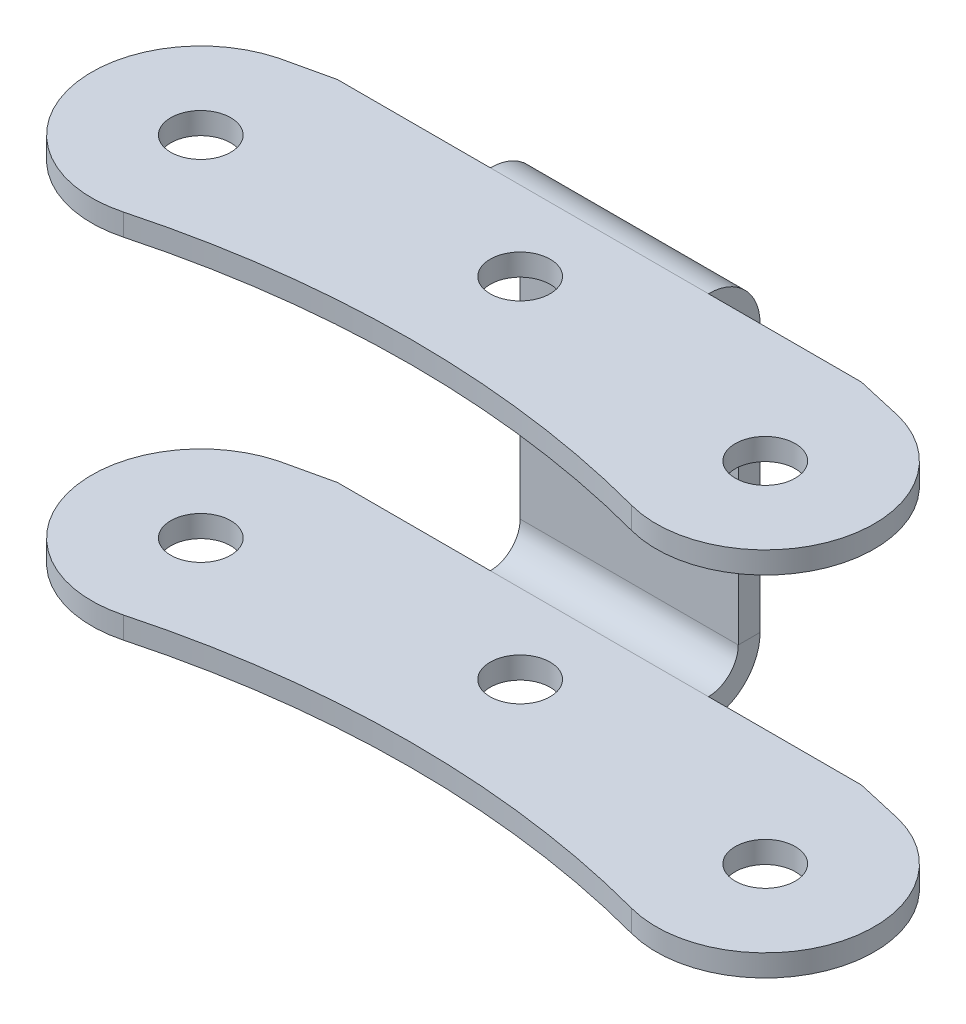
from build123d import *

# Parameters (mm, degrees)
SKETCH_1_W                       = 20
SKETCH_1_H                       = 34
SM_BASE_FLANGE_1_DEPTH           = 2
SM_EDGE_FLANGE_1_STRIP_W         = 13.4732
SM_EDGE_FLANGE_1_STRIP_H         = 2
SM_EDGE_FLANGE_1_STRIP_CUT_DEPTH = 20
SM_EDGE_FLANGE_1_DEPTH           = 20
SM_EDGE_FLANGE_1_FLAT_DEPTH      = 2
SKETCH_9_R                       = 2.75
CUT_EXTRUDE_1_DEPTH              = 55.693859429


# Sheet-metal steps are written as plain solids
with BuildPart() as part:
    # Sketch 1 → 基体-法兰1 (new body)
    with BuildSketch(Plane.XY):
        Rectangle(SKETCH_1_W, SKETCH_1_H)
    extrude(amount=-SM_BASE_FLANGE_1_DEPTH)

    # 边线-法兰1 strip (across the edge) → 边线-法兰1 strip cut (cut)
    with BuildSketch(Plane(origin=(10, 17, 0), x_dir=(0, -1, 0), z_dir=(-1, 0, 0))):
        with Locations((-2, -1)):
            Rectangle(SM_EDGE_FLANGE_1_STRIP_W, SM_EDGE_FLANGE_1_STRIP_H)
    sm_edge_flange_1_strip_cut = extrude(amount=SM_EDGE_FLANGE_1_STRIP_CUT_DEPTH, mode=Mode.SUBTRACT)

    # 边线-法兰1 bend section (across the edge) → 边线-法兰1 (add)
    with BuildSketch(Plane(origin=(10, 17, 0), x_dir=(0, -1, 0), z_dir=(-1, 0, 0))):
        with BuildLine():
            Line((0, 2.7366), (2, 2.7366))
            ThreePointArc((2, 2.7366), (2.801531583, 0.801531583), (4.7366, 0))
            Line((4.7366, 0), (4.7366, -2))
            ThreePointArc((4.7366, -2), (1.38731802, -0.61268198), (0, 2.7366))
        make_face()
    sm_edge_flange_1 = extrude(amount=SM_EDGE_FLANGE_1_DEPTH)

    # 边线-法兰1 profile (on flange) → 边线-法兰1 flat (add)
    with BuildSketch(Plane.XZ.offset(-17)):
        with BuildLine():
            ThreePointArc((23.293714059, 23.066675634), (0, 20), (-23.293714059, 23.066675634))
            ThreePointArc((-23.293714059, 23.066675634), (-35.541162773, 15.995607822), (-28.470094961, 3.748159108))
            Line((-28.470094961, 3.748159108), (-24.025119684, 2.7366))
            Line((-24.025119684, 2.7366), (24.025119684, 2.7366))
            Line((24.025119684, 2.7366), (28.470094961, 3.748159108))
            ThreePointArc((28.470094961, 3.748159108), (35.541162773, 15.995607822), (23.293714059, 23.066675634))
        make_face()
    sm_edge_flange_1_flat = extrude(amount=SM_EDGE_FLANGE_1_FLAT_DEPTH)

    # 镜向1: 边线-法兰1 strip cut, 边线-法兰1, 边线-法兰1 flat across plane
    add(sm_edge_flange_1_strip_cut.mirror(Plane.ZX), mode=Mode.SUBTRACT)
    add(sm_edge_flange_1.mirror(Plane.ZX))
    add(sm_edge_flange_1_flat.mirror(Plane.ZX))

    # 草图9 → 切除-拉伸1 (cut, through all)
    with BuildSketch(Plane(origin=(0, 17, 0), x_dir=(1, 0, 0), z_dir=(0, 1, 0))):
        with Locations(Location((0, -10, 0), (0, 0, 270))):
            Circle(SKETCH_9_R)
        with Locations(Location((25.88190451, -13.407417371, 0), (0, 0, 270))):
            Circle(SKETCH_9_R)
        with Locations(Location((-25.88190451, -13.407417371, 0), (0, 0, 270))):
            Circle(SKETCH_9_R)
    extrude(amount=-CUT_EXTRUDE_1_DEPTH, mode=Mode.SUBTRACT)


solid = part.part
